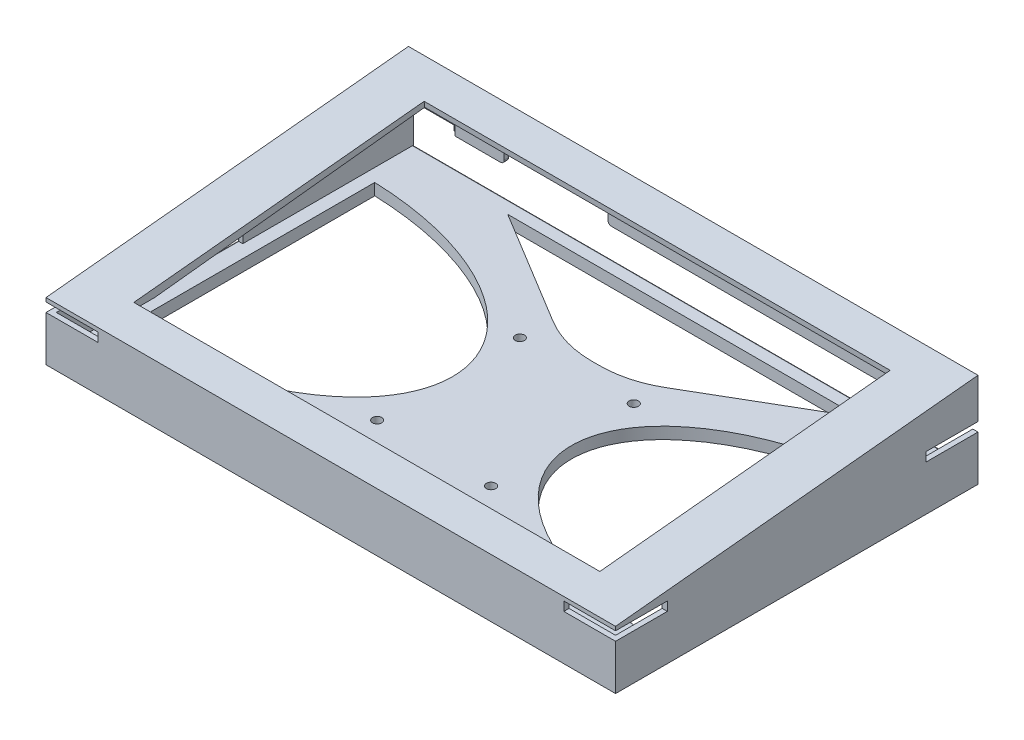
from build123d import *

# Parameters (mm, degrees)
SALIENTE_EXTRUIR1_DEPTH    = 4.5
CROQUIS2_W                 = 218
CROQUIS2_H                 = 140
CROQUIS2_W_2               = 214
CROQUIS2_H_2               = 136
SALIENTE_EXTRUIR3_DEPTH    = 15
CORTAR_EXTRUIR1_REACH      = 260.14
CROQUIS3_W                 = 214
CROQUIS3_H                 = 13
CROQUIS4_W                 = 214
CROQUIS4_H                 = 136
SALIENTE_EXTRUIR4_DEPTH    = 2
SALIENTE_EXTRUIR5_REACH    = 327.686
SALIENTE_EXTRUIR7_START    = 2
SALIENTE_EXTRUIR7_DEPTH    = 2
CORTAR_EXTRUIR2_REACH      = 326.053
CROQUIS7_R                 = 5
SALIENTE_EXTRUIR8_DEPTH    = 2
SALIENTE_EXTRUIR9_DEPTH    = 2
CORTAR_EXTRUIR3_REACH      = 327.378
CROQUIS10_W                = 178
CROQUIS10_H                = 112.801278404
CORTAR_EXTRUIR5_DEPTH      = 327.541563707
CORTAR_EXTRUIR5_DEPTH_BACK = 23
CORTAR_EXTRUIR6_DEPTH      = 23
CORTAR_EXTRUIR6_DEPTH_BACK = 23
CORTAR_EXTRUIR7_DEPTH      = 328.018948729
SALIENTE_EXTRUIR17_REACH   = 327.686
SALIENTE_EXTRUIR18_DEPTH   = 2
SALIENTE_EXTRUIR19_DEPTH   = 2
CORTAR_EXTRUIR9_REACH      = 328.541
CROQUIS23_W                = 329.217407979
CROQUIS23_H                = 118.03216019
CORTAR_EXTRUIR10_DEPTH     = 125
SALIENTE_EXTRUIR20_DEPTH   = 2
CROQUIS25_W                = 26.284271247
CROQUIS25_H                = 4
CORTAR_EXTRUIR11_DEPTH     = 31
CROQUIS26_W                = 26.284271247
CROQUIS26_H                = 4
CORTAR_EXTRUIR12_DEPTH     = 31
SALIENTE_EXTRUIR21_DEPTH   = 2
CORTAR_EXTRUIR14_DEPTH     = 325.052859489
CORTAR_EXTRUIR15_REACH     = 327.416
CROQUIS34_W                = 180
CROQUIS34_H                = 112.698258695
CORTAR_EXTRUIR16_START     = -4
CORTAR_EXTRUIR16_DEPTH     = 2
SALIENTE_EXTRUIR32_DEPTH   = 4
CORTAR_EXTRUIR20_DEPTH     = 325.052859489
SALIENTE_EXTRUIR33_DEPTH   = 4
CROQUIS50_R                = 5
CORTAR_EXTRUIR21_DEPTH     = 290.118581385
CORTAR_EXTRUIR22_REACH     = 292.619
CORTAR_EXTRUIR27_REACH     = 292.619
CROQUIS52_R                = 1.8
CROQUIS61_R                = 5
CROQUIS61_R_2              = 3.75
SALIENTE_EXTRUIR34_DEPTH   = 4
REDONDEO3_R                = 0.5
REDONDEO4_R                = 0.5
REDONDEO5_R                = 0.5
CROQUIS62_W                = 276.568542494
CROQUIS62_H                = 196.568542494
CROQUIS62_W_2              = 220
CROQUIS62_H_2              = 140
CORTAR_EXTRUIR28_DEPTH     = 10
CORTAR_EXTRUIR32_DEPTH     = 3.5
CORTAR_EXTRUIR33_DEPTH     = 3.5
CORTAR_EXTRUIR34_DEPTH     = 3.5
CROQUIS69_W                = 2
CROQUIS69_H                = 3.5
CORTAR_EXTRUIR35_DEPTH     = 20


with BuildPart() as part:
    # Croquis1 → Saliente-Extruir1 (new body)
    with BuildSketch(Plane(origin=(0, 0, 0), x_dir=(1, 0, 0), z_dir=(0, 1, 0))):
        Polygon((216, 138), (0, 138), (-2, 138), (-2, 136), (-2, -2), (214, -2), (216, -2), (216, 0), align=None)
    extrude(amount=SALIENTE_EXTRUIR1_DEPTH)

    # Croquis2 → Saliente-Extruir3 (add)
    with BuildSketch(Plane(origin=(0, 4.5, 0), x_dir=(1, 0, 0), z_dir=(0, 1, 0))):
        with Locations((107, 68)):
            Rectangle(CROQUIS2_W, CROQUIS2_H)
        with Locations((107, 68)):
            Rectangle(CROQUIS2_W_2, CROQUIS2_H_2, mode=Mode.SUBTRACT)
    extrude(amount=SALIENTE_EXTRUIR3_DEPTH)

    # Croquis3 → Cortar-Extruir1 (cut, up to next)
    with BuildSketch(Plane(origin=(0, 0, -138), x_dir=(-1, 0, 0), z_dir=(0, 0, -1)), mode=Mode.PRIVATE) as cortar_extruir1_sk1:
        with Locations((-107, 11)):
            Rectangle(CROQUIS3_W, CROQUIS3_H)
    cortar_extruir1_tool1 = extrude(cortar_extruir1_sk1.sketch, amount=-CORTAR_EXTRUIR1_REACH, mode=Mode.PRIVATE) & part.part
    add(cortar_extruir1_tool1.solids().sort_by_distance((107, 11, -138))[0], mode=Mode.SUBTRACT)

    # Croquis4 → Saliente-Extruir4 (add)
    with BuildSketch(Plane(origin=(0, 19.5, 0), x_dir=(1, 0, 0), z_dir=(0, 1, 0))):
        with BuildLine():
            Line((187.715728753, 138), (26.284271247, 138))
            Line((26.284271247, 138), (-16.142135624, 180.426406871))
            ThreePointArc((-16.142135624, 180.426406871), (-44.426406871, 180.426406871), (-44.426406871, 152.142135624))
            Line((-44.426406871, 152.142135624), (-2, 109.715728753))
            Line((-2, 109.715728753), (-2, 26.284271247))
            Line((-2, 26.284271247), (-44.426406871, -16.142135624))
            ThreePointArc((-44.426406871, -16.142135624), (-44.426406871, -44.426406871), (-16.142135624, -44.426406871))
            Line((-16.142135624, -44.426406871), (26.284271247, -2))
            Line((26.284271247, -2), (187.715728753, -2))
            Line((187.715728753, -2), (230.142135624, -44.426406871))
            ThreePointArc((230.142135624, -44.426406871), (258.426406871, -44.426406871), (258.426406871, -16.142135624))
            Line((258.426406871, -16.142135624), (216, 26.284271247))
            Line((216, 26.284271247), (216, 109.715728753))
            Line((216, 109.715728753), (258.426406871, 152.142135624))
            ThreePointArc((258.426406871, 152.142135624), (258.426406871, 180.426406871), (230.142135624, 180.426406871))
            Line((230.142135624, 180.426406871), (187.715728753, 138))
        make_face()
        with Locations((107, 68)):
            Rectangle(CROQUIS4_W, CROQUIS4_H, mode=Mode.SUBTRACT)
    extrude(amount=SALIENTE_EXTRUIR4_DEPTH)

    # Saliente-Extruir5: up to this face of the body (flat: up to its plane)
    saliente_extruir5_end = Plane(part.part.faces().sort_by_distance((216, 10.3692134, -68))[0])
    # Croquis5 → Saliente-Extruir5 (add, up to the picked face)
    with BuildSketch(Plane.ZY.offset(2), mode=Mode.PRIVATE) as saliente_extruir5_sk1:
        Polygon((-138, 34.5), (-138, 21.5), (-136, 21.5), (-136, 34.285714286), (-16.666666667, 21.5), (2, 21.5), (-138, 36.5), align=None)
    saliente_extruir5_tool1 = split(extrude(saliente_extruir5_sk1.sketch, amount=-SALIENTE_EXTRUIR5_REACH, mode=Mode.PRIVATE), bisect_by=saliente_extruir5_end, keep=Keep.BOTH, mode=Mode.PRIVATE)
    add(saliente_extruir5_tool1.solids().sort_by(Axis((-2, 28.461134, -78.343459), (1, 0, 0)))[0])

    # Croquis6 → Saliente-Extruir7 (add)
    with BuildSketch(Plane.XZ.offset(-19.5).offset(SALIENTE_EXTRUIR7_START)):
        with BuildLine():
            Line((216, -138), (187.715728753, -138))
            Line((187.715728753, -138), (230.142135624, -180.426406871))
            ThreePointArc((230.142135624, -180.426406871), (258.426406871, -180.426406871), (258.426406871, -152.142135624))
            Line((258.426406871, -152.142135624), (216, -109.715728753))
            Line((216, -109.715728753), (216, -138))
        make_face()
        with BuildLine():
            Line((-2, -138), (-2, -109.715728753))
            Line((-2, -109.715728753), (-44.426406871, -152.142135624))
            ThreePointArc((-44.426406871, -152.142135624), (-44.426406871, -180.426406871), (-16.142135624, -180.426406871))
            Line((-16.142135624, -180.426406871), (26.284271247, -138))
            Line((26.284271247, -138), (-2, -138))
        make_face()
        with BuildLine():
            Line((-2, -26.284271247), (-2, 2))
            Line((-2, 2), (26.284271247, 2))
            Line((26.284271247, 2), (-16.142135624, 44.426406871))
            ThreePointArc((-16.142135624, 44.426406871), (-44.426406871, 44.426406871), (-44.426406871, 16.142135624))
            Line((-44.426406871, 16.142135624), (-2, -26.284271247))
        make_face()
        with BuildLine():
            Line((216, 2), (187.715728753, 2))
            Line((187.715728753, 2), (230.142135624, 44.426406871))
            ThreePointArc((230.142135624, 44.426406871), (258.426406871, 44.426406871), (258.426406871, 16.142135624))
            Line((258.426406871, 16.142135624), (216, -26.284271247))
            Line((216, -26.284271247), (216, 2))
        make_face()
    extrude(amount=-SALIENTE_EXTRUIR7_DEPTH)

    # Croquis7 → Cortar-Extruir2 (cut, up to next)
    with BuildSketch(Plane(origin=(0, 21.5, 0), x_dir=(1, 0, 0), z_dir=(0, 1, 0)), mode=Mode.PRIVATE) as cortar_extruir2_sk1:
        with Locations(Location((244.284271247, -30.284271247, 0), (0, 0, 270))):
            Circle(CROQUIS7_R)
    cortar_extruir2_tool1 = extrude(cortar_extruir2_sk1.sketch, amount=-CORTAR_EXTRUIR2_REACH, mode=Mode.PRIVATE) & part.part
    # Croquis7 → Cortar-Extruir2 (cut, up to next)
    with BuildSketch(Plane(origin=(0, 21.5, 0), x_dir=(1, 0, 0), z_dir=(0, 1, 0)), mode=Mode.PRIVATE) as cortar_extruir2_sk2:
        with Locations(Location((-30.284271247, -30.284271247, 0), (0, 0, 270))):
            Circle(CROQUIS7_R)
    cortar_extruir2_tool2 = extrude(cortar_extruir2_sk2.sketch, amount=-CORTAR_EXTRUIR2_REACH, mode=Mode.PRIVATE) & part.part
    # Croquis7 → Cortar-Extruir2 (cut, up to next)
    with BuildSketch(Plane(origin=(0, 21.5, 0), x_dir=(1, 0, 0), z_dir=(0, 1, 0)), mode=Mode.PRIVATE) as cortar_extruir2_sk3:
        with Locations(Location((-30.284271247, 166.284271247, 0), (0, 0, 270))):
            Circle(CROQUIS7_R)
    cortar_extruir2_tool3 = extrude(cortar_extruir2_sk3.sketch, amount=-CORTAR_EXTRUIR2_REACH, mode=Mode.PRIVATE) & part.part
    # Croquis7 → Cortar-Extruir2 (cut, up to next)
    with BuildSketch(Plane(origin=(0, 21.5, 0), x_dir=(1, 0, 0), z_dir=(0, 1, 0)), mode=Mode.PRIVATE) as cortar_extruir2_sk4:
        with Locations(Location((244.284271247, 166.284271247, 0), (0, 0, 270))):
            Circle(CROQUIS7_R)
    cortar_extruir2_tool4 = extrude(cortar_extruir2_sk4.sketch, amount=-CORTAR_EXTRUIR2_REACH, mode=Mode.PRIVATE) & part.part
    add(cortar_extruir2_tool1.solids().sort_by_distance((244.284271, 21.5, 30.284271))[0], mode=Mode.SUBTRACT)
    add(cortar_extruir2_tool2.solids().sort_by_distance((-30.284271, 21.5, 30.284271))[0], mode=Mode.SUBTRACT)
    add(cortar_extruir2_tool3.solids().sort_by_distance((-30.284271, 21.5, -166.284271))[0], mode=Mode.SUBTRACT)
    add(cortar_extruir2_tool4.solids().sort_by_distance((244.284271, 21.5, -166.284271))[0], mode=Mode.SUBTRACT)

    # Croquis8 → Saliente-Extruir8 (add)
    with BuildSketch(Plane.ZY.offset(2)):
        Polygon((-136, 21.5), (-16.666666667, 21.5), (-136, 34.285714286), align=None)
    extrude(amount=-SALIENTE_EXTRUIR8_DEPTH)

    # Croquis9 → Saliente-Extruir9 (add)
    with BuildSketch(Plane(origin=(216, 0, 0), x_dir=(0, 0, -1), z_dir=(1, 0, 0))):
        Polygon((136, 21.5), (16.666666667, 21.5), (136, 34.285714286), align=None)
    extrude(amount=-SALIENTE_EXTRUIR9_DEPTH)

    # Croquis10 → Cortar-Extruir3 (cut, up to next)
    with BuildSketch(Plane(origin=(0, 21.467843632, 2.300126103), x_dir=(1, 0, 0), z_dir=(0, 0.994309153919809, 0.10653312363426524)), mode=Mode.PRIVATE) as cortar_extruir3_sk1:
        with Locations((107, 70.702483052)):
            Rectangle(CROQUIS10_W, CROQUIS10_H)
    cortar_extruir3_tool1 = extrude(cortar_extruir3_sk1.sketch, amount=-CORTAR_EXTRUIR3_REACH, mode=Mode.PRIVATE) & part.part
    add(cortar_extruir3_tool1.solids().sort_by_distance((107, 29, -68))[0], mode=Mode.SUBTRACT)

    # Croquis11 → Cortar-Extruir5 (cut, two sides: drawn at the far end of the back side and taken through both)
    with BuildSketch(Plane(origin=(0, 0, -138), x_dir=(-1, 0, 0), z_dir=(0, 0, -1)).offset(-CORTAR_EXTRUIR5_DEPTH_BACK)):
        with BuildLine():
            Line((-75, 17.5), (-35, 17.5))
            Line((-35, 17.5), (-33.5, 17.5))
            ThreePointArc((-33.5, 17.5), (-34.560660172, 17.939339828), (-35, 19))
            Line((-35, 19), (-35, 28))
            ThreePointArc((-35, 28), (-35.439339828, 29.060660172), (-36.5, 29.5))
            Line((-36.5, 29.5), (-73.5, 29.5))
            ThreePointArc((-73.5, 29.5), (-74.560660172, 29.060660172), (-75, 28))
            Line((-75, 28), (-75, 19))
            ThreePointArc((-75, 19), (-75.439339828, 17.939339828), (-76.5, 17.5))
            Line((-76.5, 17.5), (-75, 17.5))
        make_face()
    extrude(amount=CORTAR_EXTRUIR5_DEPTH + CORTAR_EXTRUIR5_DEPTH_BACK, mode=Mode.SUBTRACT)

    # Croquis12 → Cortar-Extruir6 (cut, two sides: drawn at the far end of the back side and taken through both)
    with BuildSketch(Plane.ZY.offset(2).offset(-CORTAR_EXTRUIR6_DEPTH_BACK)):
        with BuildLine():
            Line((-21.5, 4.5), (-70.5, 4.5))
            ThreePointArc((-70.5, 4.5), (-71.560660172, 4.939339828), (-72, 6))
            Line((-72, 6), (-72, 25.759272017))
            ThreePointArc((-72, 25.759272017), (-71.502571811, 26.875000373), (-70.340200315, 27.250735748))
            Line((-70.340200315, 27.250735748), (-21.340200315, 22.000735748))
            ThreePointArc((-21.340200315, 22.000735748), (-20.384271644, 21.511843828), (-20, 20.509272017))
            Line((-20, 20.509272017), (-20, 6))
            ThreePointArc((-20, 6), (-20.439339828, 4.939339828), (-21.5, 4.5))
        make_face()
    extrude(amount=CORTAR_EXTRUIR6_DEPTH + CORTAR_EXTRUIR6_DEPTH_BACK, mode=Mode.SUBTRACT)

    # Croquis13 → Cortar-Extruir7 (cut, through all)
    with BuildSketch(Plane.ZY.offset(2)):
        Polygon((2, 21.5), (-138, 21.5), (-138, 36.5), align=None)
    extrude(amount=-CORTAR_EXTRUIR7_DEPTH, mode=Mode.SUBTRACT)

    # Saliente-Extruir17: up to this face of the body (flat: up to its plane)
    saliente_extruir17_end = Plane(part.part.faces().sort_by_distance((216, 10.038759343, -68))[0])
    # Croquis14 → Saliente-Extruir17 (add, up to the picked face)
    with BuildSketch(Plane.ZY.offset(2), mode=Mode.PRIVATE) as saliente_extruir17_sk1:
        Polygon((2, 21.498759322), (2, 22.498759322), (-138, 36.498759322), (-138, 21.498759322), (-136, 21.498759322), (-136, 34.278420339), (-20, 21.498759322), (0, 21.498759322), align=None)
    saliente_extruir17_tool1 = split(extrude(saliente_extruir17_sk1.sketch, amount=-SALIENTE_EXTRUIR17_REACH, mode=Mode.PRIVATE), bisect_by=saliente_extruir17_end, keep=Keep.BOTH, mode=Mode.PRIVATE)
    add(saliente_extruir17_tool1.solids().sort_by(Axis((-2, 28.008661, -70.967961), (1, 0, 0)))[0])

    # Croquis20 → Saliente-Extruir18 (add)
    with BuildSketch(Plane.ZY.offset(2)):
        with BuildLine():
            Line((-136, 21.5), (-72, 21.5))
            Line((-72, 21.5), (-72, 25.553243112))
            ThreePointArc((-72, 25.553243112), (-71.500901942, 26.670469724), (-70.335739596, 27.044222159))
            Line((-70.335739596, 27.044222159), (-72, 27.227572882))
            Line((-72, 27.227572882), (-136, 34.278420339))
            Line((-136, 34.278420339), (-136, 21.5))
        make_face()
    extrude(amount=-SALIENTE_EXTRUIR18_DEPTH)

    # Croquis21 → Saliente-Extruir19 (add)
    with BuildSketch(Plane(origin=(216, 0, 0), x_dir=(0, 0, -1), z_dir=(1, 0, 0))):
        Polygon((20.011261536, 21.5), (136, 34.278420339), (136, 21.5), align=None)
    extrude(amount=-SALIENTE_EXTRUIR19_DEPTH)

    # Croquis22 → Cortar-Extruir9 (cut, up to next)
    with BuildSketch(Plane(origin=(0, 0, -138), x_dir=(-1, 0, 0), z_dir=(0, 0, -1)), mode=Mode.PRIVATE) as cortar_extruir9_sk1:
        with BuildLine():
            Line((-75, 28), (-75, 21.498759322))
            Line((-75, 21.498759322), (-35, 21.498759322))
            Line((-35, 21.498759322), (-35, 28))
            ThreePointArc((-35, 28), (-35.439339828, 29.060660172), (-36.5, 29.5))
            Line((-36.5, 29.5), (-73.5, 29.5))
            ThreePointArc((-73.5, 29.5), (-74.560660172, 29.060660172), (-75, 28))
        make_face()
    cortar_extruir9_tool1 = extrude(cortar_extruir9_sk1.sketch, amount=-CORTAR_EXTRUIR9_REACH, mode=Mode.PRIVATE) & part.part
    add(cortar_extruir9_tool1.solids().sort_by_distance((55, 25.488286, -138))[0], mode=Mode.SUBTRACT)

    # Croquis23 → Cortar-Extruir10 (cut)
    with BuildSketch(Plane(origin=(0, 0, 0), x_dir=(0, 0, -1), z_dir=(1, 0, 0))):
        with Locations((63.508659293, 42.721054458)):
            Rectangle(CROQUIS23_W, CROQUIS23_H)
    extrude(amount=-CORTAR_EXTRUIR10_DEPTH, mode=Mode.SUBTRACT)

    # Croquis24 → Saliente-Extruir20 (add)
    with BuildSketch(Plane.ZY):
        Polygon((-138, 4.5), (-138, 0), (2, 0), (2, 22.498759322), (-138, 36.498759322), (-138, 17.5), (-136, 17.5), (-136, 34.278420339), (-20, 21.498759322), (0, 21.498759322), (0, 4.5), align=None)
    extrude(amount=SALIENTE_EXTRUIR20_DEPTH)

    # Croquis25 → Cortar-Extruir11 (cut)
    with BuildSketch(Plane.ZY):
        with Locations((-151.142135623, 19.5)):
            Rectangle(CROQUIS25_W, CROQUIS25_H)
    extrude(amount=-CORTAR_EXTRUIR11_DEPTH, mode=Mode.SUBTRACT)

    # Croquis26 → Cortar-Extruir12 (cut)
    with BuildSketch(Plane.ZY):
        with Locations((15.142135624, 19.5)):
            Rectangle(CROQUIS26_W, CROQUIS26_H)
    extrude(amount=-CORTAR_EXTRUIR12_DEPTH, mode=Mode.SUBTRACT)

    # Croquis27 → Saliente-Extruir21 (add)
    with BuildSketch(Plane.ZY.offset(2)):
        Polygon((-138, 36.498759322), (2, 22.498759322), (2, 0), (-138, 0), align=None)
        Polygon((-21.998897796, 21.718976876), (-71.998897796, 21.718976876), (-71.998897796, 9.718976876), (-71.998897796, 4.5), (-21.998897796, 4.5), (-21.998897796, 9.718976876), align=None, mode=Mode.SUBTRACT)
    extrude(amount=SALIENTE_EXTRUIR21_DEPTH)

    # Croquis32 → Cortar-Extruir14 (cut, through all)
    with BuildSketch(Plane(origin=(0, 21.5, 0), x_dir=(1, 0, 0), z_dir=(0, 1, 0))):
        Polygon((216, 26.284271247), (216, -2), (187.715728753, -2), (230.142135624, -44.426406871), (251.355339059, -65.639610307), (295.744415963, -27.157073484), align=None)
    extrude(amount=-CORTAR_EXTRUIR14_DEPTH, mode=Mode.SUBTRACT)

    # Croquis34 → Cortar-Extruir15 (cut, up to next)
    with BuildSketch(Plane(origin=(0, 22.474019131, 2.247401913), x_dir=(1, 0, 0), z_dir=(0, 0.9950371902099893, 0.09950371902099896)), mode=Mode.PRIVATE) as cortar_extruir15_sk1:
        with Locations((106, 70.597765194)):
            Rectangle(CROQUIS34_W, CROQUIS34_H)
    cortar_extruir15_tool1 = extrude(cortar_extruir15_sk1.sketch, amount=-CORTAR_EXTRUIR15_REACH, mode=Mode.PRIVATE) & part.part
    add(cortar_extruir15_tool1.solids().sort_by_distance((106, 29.498759, -68))[0], mode=Mode.SUBTRACT)

    # Cortar-Extruir16: read off the stored shape, not the designer's step
    # Cortar-Extruir16 outline → Cortar-Extruir16 (cut)
    with BuildSketch(Plane.YZ.offset(CORTAR_EXTRUIR16_START)):
        Polygon((21.718976876, -71.998897796), (27.227451452, -71.998897796), (21.718976876, -21.998897796), align=None)
    extrude(amount=CORTAR_EXTRUIR16_DEPTH, mode=Mode.SUBTRACT)

    # Croquis47 → Saliente-Extruir32 (add)
    with BuildSketch(Plane.XZ.offset(-17.5)):
        with BuildLine():
            Line((4.838834765, 10.838834765), (13.67766953, 2))
            Line((13.67766953, 2), (-4, 2))
            Line((-4, 2), (-4, -15.67766953))
            Line((-4, -15.67766953), (-12.838834765, -6.838834765))
            Line((-12.838834765, -6.838834765), (-23.445436483, 3.767766953))
            ThreePointArc((-23.445436483, 3.767766953), (-23.445436483, 21.445436483), (-5.767766953, 21.445436483))
            Line((-5.767766953, 21.445436483), (4.838834765, 10.838834765))
        make_face()
        with BuildLine():
            Line((207.161165235, 10.838834765), (217.767766953, 21.445436483))
            ThreePointArc((217.767766953, 21.445436483), (235.445436483, 21.445436483), (235.445436483, 3.767766953))
            Line((235.445436483, 3.767766953), (224.838834765, -6.838834765))
            Line((224.838834765, -6.838834765), (216, -15.67766953))
            Line((216, -15.67766953), (216, 2))
            Line((216, 2), (198.32233047, 2))
            Line((198.32233047, 2), (207.161165235, 10.838834765))
        make_face()
        with BuildLine():
            Line((4.838834765, -146.838834765), (-5.767766953, -157.445436483))
            ThreePointArc((-5.767766953, -157.445436483), (-23.445436483, -157.445436483), (-23.445436483, -139.767766953))
            Line((-23.445436483, -139.767766953), (-12.838834765, -129.161165235))
            Line((-12.838834765, -129.161165235), (-4, -120.32233047))
            Line((-4, -120.32233047), (-4, -138))
            Line((-4, -138), (13.67766953, -138))
            Line((13.67766953, -138), (4.838834765, -146.838834765))
        make_face()
    extrude(amount=-SALIENTE_EXTRUIR32_DEPTH)

    # Croquis48 → Cortar-Extruir20 (cut, through all)
    with BuildSketch(Plane(origin=(0, 21.5, 0), x_dir=(1, 0, 0), z_dir=(0, 1, 0))):
        Polygon((187.715728753, 138), (216, 138), (216, 109.715728753), (283.685629502, 109.715728753), (283.685629502, 200.420541707), (173.75613057, 200.420541707), align=None)
    extrude(amount=-CORTAR_EXTRUIR20_DEPTH, mode=Mode.SUBTRACT)

    # Croquis49 → Saliente-Extruir33 (add)
    with BuildSketch(Plane.XZ.offset(-17.5)):
        with BuildLine():
            Line((224.838834765, -129.161165235), (216, -120.32233047))
            Line((216, -120.32233047), (216, -138))
            Line((216, -138), (198.32233047, -138))
            Line((198.32233047, -138), (207.161165235, -146.838834765))
            Line((207.161165235, -146.838834765), (217.767766953, -157.445436483))
            ThreePointArc((217.767766953, -157.445436483), (235.445436483, -157.445436483), (235.445436483, -139.767766953))
            Line((235.445436483, -139.767766953), (224.838834765, -129.161165235))
        make_face()
    extrude(amount=-SALIENTE_EXTRUIR33_DEPTH)

    # Croquis50 → Cortar-Extruir21 (cut, through all)
    with BuildSketch(Plane(origin=(0, 21.5, 0), x_dir=(1, 0, 0), z_dir=(0, 1, 0))):
        with Locations(Location((226.606601718, -12.606601718, 0), (0, 0, 270))):
            Circle(CROQUIS50_R)
        with Locations(Location((226.606601718, 148.606601718, 0), (0, 0, 270))):
            Circle(CROQUIS50_R)
        with Locations(Location((-14.606601718, 148.606601718, 0), (0, 0, 270))):
            Circle(CROQUIS50_R)
        with Locations(Location((-14.606601718, -12.606601718, 0), (0, 0, 270))):
            Circle(CROQUIS50_R)
    extrude(amount=-CORTAR_EXTRUIR21_DEPTH, mode=Mode.SUBTRACT)

    # Croquis51 → Cortar-Extruir22 (cut, up to next)
    with BuildSketch(Plane.XZ, mode=Mode.PRIVATE) as cortar_extruir22_sk1:
        with BuildLine():
            Line((169.529411765, -3), (42.470588235, -3))
            Line((42.470588235, -3), (67.603918163, -18.824689214))
            ThreePointArc((67.603918163, -18.824689214), (72.29992127, -21.360688689), (77.291737396, -23.248944575))
            Line((77.291737396, -23.248944575), (94.375288445, -28.437678175))
            ThreePointArc((94.375288445, -28.437678175), (106, -30.164109211), (117.624711555, -28.437678175))
            Line((117.624711555, -28.437678175), (134.708262604, -23.248944575))
            ThreePointArc((134.708262604, -23.248944575), (139.70007873, -21.360688689), (144.396081837, -18.824689214))
            Line((144.396081837, -18.824689214), (169.529411765, -3))
        make_face()
    cortar_extruir22_tool1 = extrude(cortar_extruir22_sk1.sketch, amount=-CORTAR_EXTRUIR22_REACH, mode=Mode.PRIVATE) & part.part
    # Croquis51 → Cortar-Extruir22 (cut, up to next)
    with BuildSketch(Plane.XZ, mode=Mode.PRIVATE) as cortar_extruir22_sk2:
        with BuildLine():
            Line((3, -18.02187757), (3, -117.97812243))
            add(Edge.make_bspline(
                [(3, -117.97812243), (83, -115.201560073), (83, -68), (83, -20.798439927), (3, -18.02187757)],
                knots=[4.771246486, 4.771246486, 4.771246486, 6.283185307, 6.283185307, 7.795124128, 7.795124128, 7.795124128], degree=2, weights=[1, 0.727606875, 1, 0.727606875, 1]))
        make_face()
    cortar_extruir22_tool2 = extrude(cortar_extruir22_sk2.sketch, amount=-CORTAR_EXTRUIR22_REACH, mode=Mode.PRIVATE) & part.part
    # Croquis51 → Cortar-Extruir22 (cut, up to next)
    with BuildSketch(Plane.XZ, mode=Mode.PRIVATE) as cortar_extruir22_sk3:
        with BuildLine():
            Line((209, -116.507309476), (209, -19.492690524))
            add(Edge.make_bspline(
                [(209, -19.492690524), (129, -22.187541051), (129, -68), (129, -113.812458949), (209, -116.507309476)],
                knots=[4.771246486, 4.771246486, 4.771246486, 6.283185307, 6.283185307, 7.795124128, 7.795124128, 7.795124128], degree=2, weights=[1, 0.727606875, 1, 0.727606875, 1]))
        make_face()
    cortar_extruir22_tool3 = extrude(cortar_extruir22_sk3.sketch, amount=-CORTAR_EXTRUIR22_REACH, mode=Mode.PRIVATE) & part.part
    # Croquis51 → Cortar-Extruir22 (cut, up to next)
    with BuildSketch(Plane.XZ, mode=Mode.PRIVATE) as cortar_extruir22_sk4:
        with BuildLine():
            ThreePointArc((127.826191695, -105.555910662), (118.127642911, -101.510018299), (107.710079825, -100.12962963))
            Line((107.710079825, -100.12962963), (104.689575706, -100.12962963))
            ThreePointArc((104.689575706, -100.12962963), (93.913688068, -101.608463427), (83.934587772, -105.935617349))
            Line((83.934587772, -105.935617349), (39.345796121, -133))
            Line((39.345796121, -133), (174.994562908, -133))
            Line((174.994562908, -133), (127.826191695, -105.555910662))
        make_face()
    cortar_extruir22_tool4 = extrude(cortar_extruir22_sk4.sketch, amount=-CORTAR_EXTRUIR22_REACH, mode=Mode.PRIVATE) & part.part
    add(cortar_extruir22_tool1.solids().sort_by_distance((106, 0, -13.476124))[0], mode=Mode.SUBTRACT)
    add(cortar_extruir22_tool2.solids().sort_by_distance((36.81116, 0, -68))[0], mode=Mode.SUBTRACT)
    add(cortar_extruir22_tool3.solids().sort_by_distance((175.205196, 0, -68))[0], mode=Mode.SUBTRACT)
    add(cortar_extruir22_tool4.solids().sort_by_distance((106.730328, 0, -120.492402))[0], mode=Mode.SUBTRACT)

    # Croquis52 → Cortar-Extruir27 (cut, up to next)
    with BuildSketch(Plane.XZ, mode=Mode.PRIVATE) as cortar_extruir27_sk1:
        with Locations(Location((83, -38.909799263, 0), (0, 0, 270))):
            Circle(CROQUIS52_R)
    cortar_extruir27_tool1 = extrude(cortar_extruir27_sk1.sketch, amount=-CORTAR_EXTRUIR27_REACH, mode=Mode.PRIVATE) & part.part
    # Croquis52 → Cortar-Extruir27 (cut, up to next)
    with BuildSketch(Plane.XZ, mode=Mode.PRIVATE) as cortar_extruir27_sk2:
        with Locations(Location((127, -38.909799263, 0), (0, 0, 270))):
            Circle(CROQUIS52_R)
    cortar_extruir27_tool2 = extrude(cortar_extruir27_sk2.sketch, amount=-CORTAR_EXTRUIR27_REACH, mode=Mode.PRIVATE) & part.part
    # Croquis52 → Cortar-Extruir27 (cut, up to next)
    with BuildSketch(Plane.XZ, mode=Mode.PRIVATE) as cortar_extruir27_sk3:
        with Locations(Location((127, -94.044511046, 0), (0, 0, 270))):
            Circle(CROQUIS52_R)
    cortar_extruir27_tool3 = extrude(cortar_extruir27_sk3.sketch, amount=-CORTAR_EXTRUIR27_REACH, mode=Mode.PRIVATE) & part.part
    # Croquis52 → Cortar-Extruir27 (cut, up to next)
    with BuildSketch(Plane.XZ, mode=Mode.PRIVATE) as cortar_extruir27_sk4:
        with Locations(Location((83, -94.044511046, 0), (0, 0, 270))):
            Circle(CROQUIS52_R)
    cortar_extruir27_tool4 = extrude(cortar_extruir27_sk4.sketch, amount=-CORTAR_EXTRUIR27_REACH, mode=Mode.PRIVATE) & part.part
    add(cortar_extruir27_tool1.solids().sort_by_distance((83, 0, -38.909799))[0], mode=Mode.SUBTRACT)
    add(cortar_extruir27_tool2.solids().sort_by_distance((127, 0, -38.909799))[0], mode=Mode.SUBTRACT)
    add(cortar_extruir27_tool3.solids().sort_by_distance((127, 0, -94.044511))[0], mode=Mode.SUBTRACT)
    add(cortar_extruir27_tool4.solids().sort_by_distance((83, 0, -94.044511))[0], mode=Mode.SUBTRACT)

    # Croquis61 → Saliente-Extruir34 (add)
    # profile 1 of 4: a face of its own
    with BuildSketch(Plane(origin=(0, 21.5, 0), x_dir=(1, 0, 0), z_dir=(0, 1, 0))):
        with Locations((-14.606601718, 148.606601718)):
            Circle(CROQUIS61_R)
        with Locations(Location((-14.606601718, 148.606601718, 0), (0, 0, 270))):
            Circle(CROQUIS61_R_2, mode=Mode.SUBTRACT)
    # profile 2 of 4: a face of its own
    with BuildSketch(Plane(origin=(0, 21.5, 0), x_dir=(1, 0, 0), z_dir=(0, 1, 0))):
        with Locations((226.606601718, 148.606601718)):
            Circle(CROQUIS61_R)
        with Locations(Location((226.606601718, 148.606601718, 0), (0, 0, 270))):
            Circle(CROQUIS61_R_2, mode=Mode.SUBTRACT)
    # profile 3 of 4: a face of its own
    with BuildSketch(Plane(origin=(0, 21.5, 0), x_dir=(1, 0, 0), z_dir=(0, 1, 0))):
        with Locations((226.606601718, -12.606601718)):
            Circle(CROQUIS61_R)
        with Locations(Location((226.606601718, -12.606601718, 0), (0, 0, 270))):
            Circle(CROQUIS61_R_2, mode=Mode.SUBTRACT)
    # profile 4 of 4: a face of its own
    with BuildSketch(Plane(origin=(0, 21.5, 0), x_dir=(1, 0, 0), z_dir=(0, 1, 0))):
        with Locations((-14.606601718, -12.606601718)):
            Circle(CROQUIS61_R)
        with Locations(Location((-14.606601718, -12.606601718, 0), (0, 0, 270))):
            Circle(CROQUIS61_R_2, mode=Mode.SUBTRACT)
    extrude(amount=-SALIENTE_EXTRUIR34_DEPTH)

    # Redondeo3
    redondeo3_edges = [part.edges().sort_by_distance(p)[0] for p in [
        (-4, 13.109488438, -71.998897796),
        (-4, 4.5, -46.998897796),
        (-4, 13.109488438, -21.998897796),
        (-4, 24.473214164, -46.998897796),
    ]]
    fillet(redondeo3_edges, radius=REDONDEO3_R)

    # Redondeo4
    redondeo4_edges = [part.edges().sort_by_distance(p)[0] for p in [
        (137.411165235, 17.5, -138),
        (35, 23.5, -138),
        (34.560660172, 17.939339828, -138),
        (75.439339828, 17.939339828, -138),
        (75, 23.5, -138),
        (55, 29.5, -138),
        (35.439339828, 29.060660172, -138),
        (74.560660172, 29.060660172, -138),
        (23.588834765, 17.5, -138),
    ]]
    fillet(redondeo4_edges, radius=REDONDEO4_R)

    # Redondeo5
    redondeo5_edges = [part.edges().sort_by_distance(p)[0] for p in [
        (106, 4.5, -138),
    ]]
    fillet(redondeo5_edges, radius=REDONDEO5_R)

    # Croquis62 → Cortar-Extruir28 (cut)
    with BuildSketch(Plane(origin=(0, 21.5, 0), x_dir=(1, 0, 0), z_dir=(0, 1, 0))):
        with Locations((106, 68)):
            Rectangle(CROQUIS62_W, CROQUIS62_H)
        with Locations((106, 68)):
            Rectangle(CROQUIS62_W_2, CROQUIS62_H_2, mode=Mode.SUBTRACT)
    extrude(amount=-CORTAR_EXTRUIR28_DEPTH, mode=Mode.SUBTRACT)

    # Croquis63 → Cortar-Extruir32 (cut)
    with BuildSketch(Plane(origin=(0, 17.5, 0), x_dir=(-1, 0, 0), z_dir=(0, -1, 0))):
        Polygon((2, 136), (2, 138), (-13.67766953, 138), (-14.17766953, 137.5), (-16, 137.5), (-16, 136), align=None)
        Polygon((-214, 118), (-214, 136), (-196, 136), (-196, 138), (-216, 138), (-216, 118), align=None)
    extrude(amount=-CORTAR_EXTRUIR32_DEPTH, mode=Mode.SUBTRACT)

    # Croquis67 → Cortar-Extruir33 (cut)
    with BuildSketch(Plane(origin=(0, 17.5, 0), x_dir=(1, 0, 0), z_dir=(0, 1, 0))):
        Polygon((196, 0), (196, -2), (214, -2), (216, -2), (216, 18), (214, 18), (214, 0), align=None)
    extrude(amount=CORTAR_EXTRUIR33_DEPTH, mode=Mode.SUBTRACT)

    # Croquis68 → Cortar-Extruir34 (cut)
    with BuildSketch(Plane(origin=(0, 17.5, 0), x_dir=(1, 0, 0), z_dir=(0, 1, 0))):
        Polygon((-4, -2), (16, -2), (16, 0), (-2, 0), (-2, 18), (-4, 18), align=None)
    extrude(amount=CORTAR_EXTRUIR34_DEPTH, mode=Mode.SUBTRACT)

    # Croquis69 → Cortar-Extruir35 (cut)
    with BuildSketch(Plane(origin=(0, 0, -138), x_dir=(-1, 0, 0), z_dir=(0, 0, -1))):
        with Locations((3, 19.25)):
            Rectangle(CROQUIS69_W, CROQUIS69_H)
    extrude(amount=-CORTAR_EXTRUIR35_DEPTH, mode=Mode.SUBTRACT)


solid = part.part
